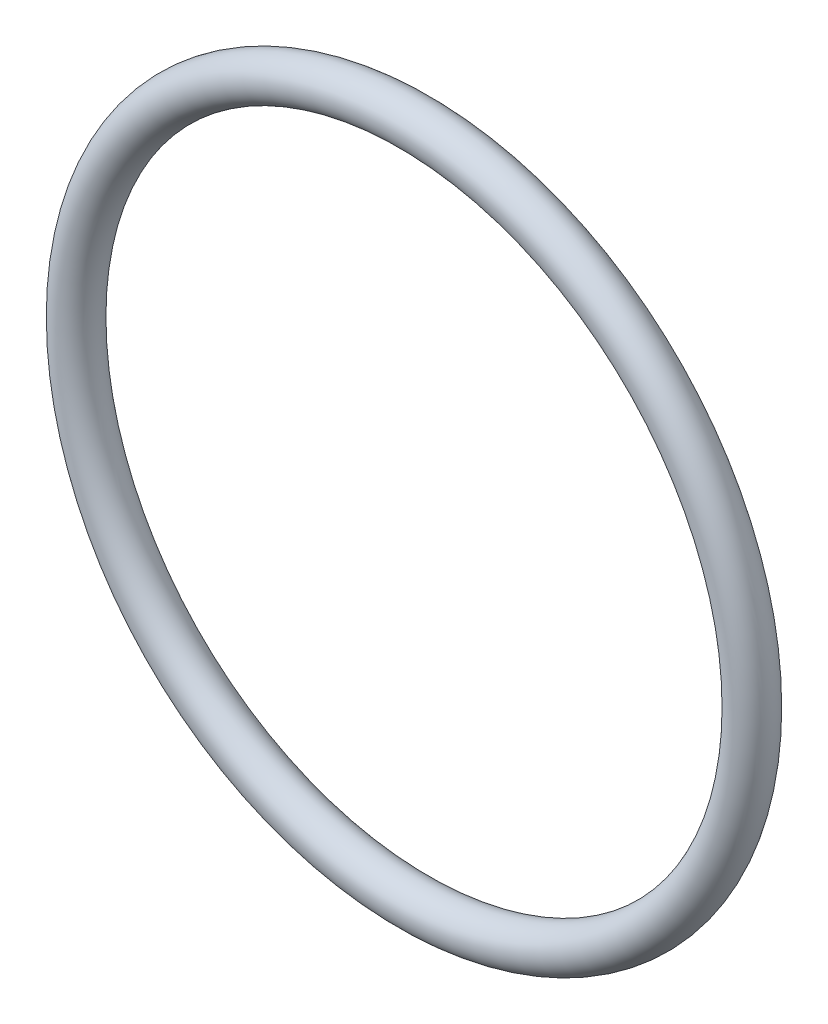
from build123d import *

# Parameters (mm, degrees)
SKETCH1_R = 0.889


with BuildPart() as part:
    # Sketch1 → Revolve1 (revolve)
    with BuildSketch(Plane(origin=(0, 0, 0), x_dir=(0, -1, 0), z_dir=(1, 0, 0))):
        with Locations((14.2367, 0)):
            Circle(SKETCH1_R)
    revolve(axis=Axis((0, 0, 0.889), (0, 0, -1)))


solid = part.part
